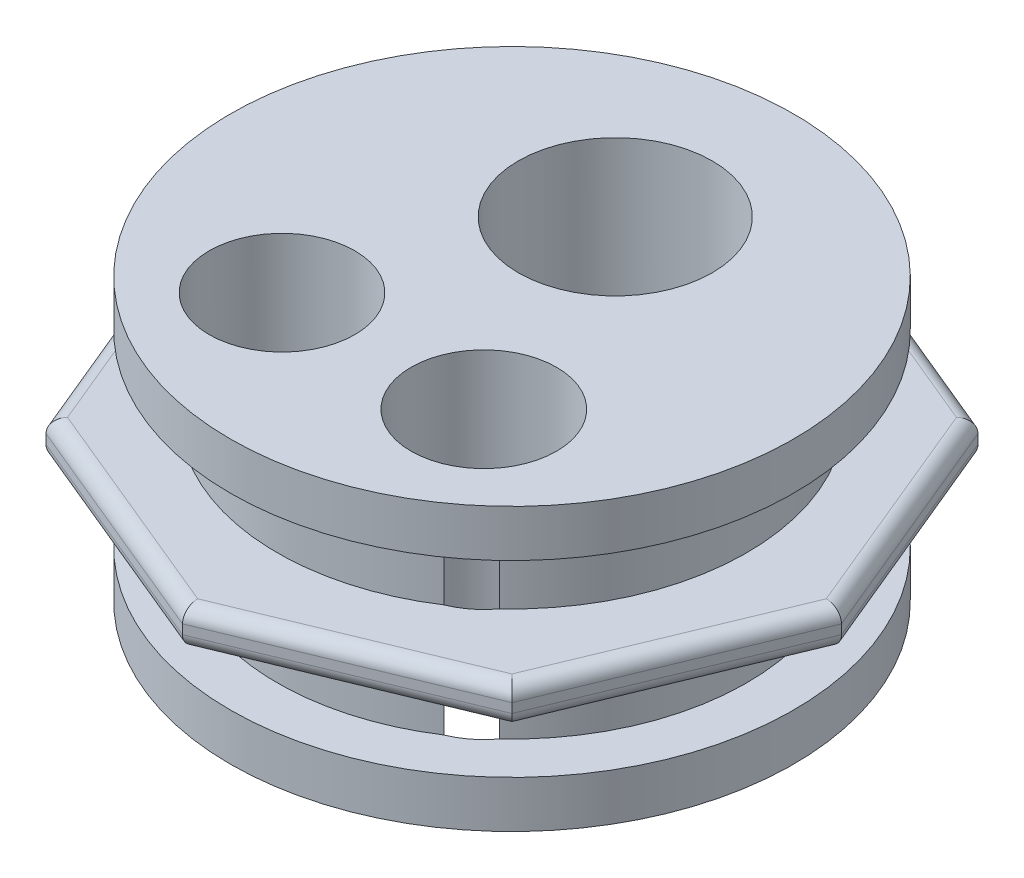
from build123d import *

# Parameters (mm, degrees)
BOSS_EXTRUDE1_DEPTH  = 2
SKETCH12_R           = 25
BOSS_EXTRUDE2_DEPTH  = 8
CUT_EXTRUDE6_START   = -36
SKETCH17_R           = 10.33
CUT_EXTRUDE6_DEPTH   = 45.856111051
SKETCH25_R           = 30
BOSS_EXTRUDE3_DEPTH  = 5
CUT_EXTRUDE9_START   = -53
SKETCH26_R           = 10.33
CUT_EXTRUDE9_DEPTH   = 53
FILLET3_R            = 1.5
SKETCH23_R           = 7.75
CUT_EXTRUDE11_DEPTH  = 36
FILLET3_OF_MIRROR1_R = 1.5
CUT_EXTRUDE12_START  = -10
SKETCH28_R           = 10.33
CUT_EXTRUDE12_DEPTH  = 10


with BuildPart() as part:
    # Sketch3 → Boss-Extrude1 (new body)
    with BuildSketch(Plane(origin=(0, 0, 0), x_dir=(1, 0, 0), z_dir=(0, 1, 0))):
        Polygon((35.1, 0), (24.81944802, 24.81944802), (0, 35.1), (-24.81944802, 24.81944802), (-35.1, 0), (-24.81944802, -24.81944802), (0, -35.1), (24.81944802, -24.81944802), align=None)
    boss_extrude1 = extrude(amount=BOSS_EXTRUDE1_DEPTH)

    # Sketch12 → Boss-Extrude2 (add)
    with BuildSketch(Plane(origin=(0, 2, 0), x_dir=(1, 0, 0), z_dir=(0, 1, 0))):
        Circle(SKETCH12_R)
    boss_extrude2 = extrude(amount=BOSS_EXTRUDE2_DEPTH)

    # Sketch17 → Cut-Extrude6 (cut)
    with BuildSketch(Plane(origin=(0, 10, 0), x_dir=(1, 0, 0), z_dir=(0, 1, 0)).offset(CUT_EXTRUDE6_START)):
        with Locations((0, 11)):
            Circle(SKETCH17_R)
    cut_extrude6 = extrude(amount=CUT_EXTRUDE6_DEPTH, mode=Mode.SUBTRACT)

    # Sketch25 → Boss-Extrude3 (add)
    with BuildSketch(Plane(origin=(0, 10, 0), x_dir=(1, 0, 0), z_dir=(0, 1, 0))):
        Circle(SKETCH25_R)
    boss_extrude3 = extrude(amount=BOSS_EXTRUDE3_DEPTH)

    # Sketch26 → Cut-Extrude9 (cut)
    with BuildSketch(Plane(origin=(0, 15, 0), x_dir=(1, 0, 0), z_dir=(0, 1, 0)).offset(CUT_EXTRUDE9_START)):
        with Locations((0, 11)):
            Circle(SKETCH26_R)
    extrude(amount=CUT_EXTRUDE9_DEPTH, mode=Mode.SUBTRACT)

    # Fillet3
    fillet3_edges = [part.edges().sort_by_distance(p)[0] for p in [
        (12.40972401, 2, 29.95972401),
        (29.95972401, 2, 12.40972401),
        (-12.40972401, 2, 29.95972401),
        (-29.95972401, 2, 12.40972401),
        (-29.95972401, 2, -12.40972401),
        (29.95972401, 2, -12.40972401),
        (-12.40972401, 2, -29.95972401),
        (12.40972401, 2, -29.95972401),
    ]]
    fillet(fillet3_edges, radius=FILLET3_R)

    # Sketch23 → Cut-Extrude11 (cut, symmetric)
    with BuildSketch(Plane(origin=(0, 10, 0), x_dir=(1, 0, 0), z_dir=(0, 1, 0))):
        with Locations((-10.75, -13.75)):
            Circle(SKETCH23_R)
        with Locations((10.75, -13.75)):
            Circle(SKETCH23_R)
    cut_extrude11 = extrude(amount=CUT_EXTRUDE11_DEPTH, both=True, mode=Mode.SUBTRACT)

    # Mirror1: Boss-Extrude1, Boss-Extrude2, Cut-Extrude6, Boss-Extrude3, Cut-Extrude11 across plane
    add(boss_extrude1.mirror(Plane.ZX))
    add(boss_extrude2.mirror(Plane.ZX))
    add(cut_extrude6.mirror(Plane.ZX), mode=Mode.SUBTRACT)
    add(boss_extrude3.mirror(Plane.ZX))
    add(cut_extrude11.mirror(Plane.ZX), mode=Mode.SUBTRACT)

    # Fillet3 of Mirror1
    fillet3_of_mirror1_edges = [part.edges().sort_by_distance(p)[0] for p in [
        (12.40972401, -2, 29.95972401),
        (29.95972401, -2, 12.40972401),
        (-12.40972401, -2, 29.95972401),
        (-29.95972401, -2, 12.40972401),
        (-29.95972401, -2, -12.40972401),
        (29.95972401, -2, -12.40972401),
        (-12.40972401, -2, -29.95972401),
        (12.40972401, -2, -29.95972401),
    ]]
    fillet(fillet3_of_mirror1_edges, radius=FILLET3_OF_MIRROR1_R)

    # Sketch28 → Cut-Extrude12 (cut)
    with BuildSketch(Plane.XZ.offset(15).offset(CUT_EXTRUDE12_START)):
        with Locations((0, -11)):
            Circle(SKETCH28_R)
    extrude(amount=CUT_EXTRUDE12_DEPTH, mode=Mode.SUBTRACT)


solid = part.part
